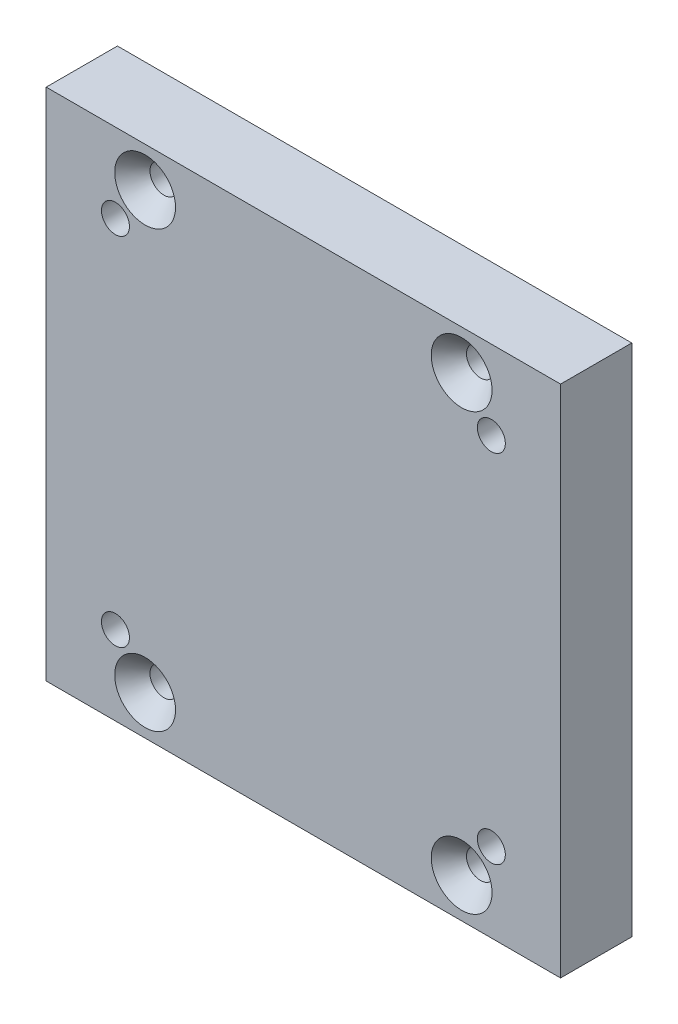
from build123d import *

# Parameters (mm, degrees)
SKETCH1_W                                      = 82.55
SKETCH1_H                                      = 82.55
BOSS_EXTRUDE1_DEPTH                            = 11.43
SKETCH2_R                                      = 38.1
CUT_EXTRUDE1_DEPTH                             = 8.89
CSK_FOR_8_FLAT_HEAD_MACHINE_SCREW1_D           = 4.4958
CSK_FOR_8_FLAT_HEAD_MACHINE_SCREW1_CSINK_D     = 9.7576132
CSK_FOR_8_FLAT_HEAD_MACHINE_SCREW1_CSINK_ANGLE = 82
F_8_CLEARANCE_HOLE1_D                          = 4.4958


with BuildPart() as part:
    # Sketch1 → Boss-Extrude1 (new body)
    with BuildSketch(Plane.XY):
        Rectangle(SKETCH1_W, SKETCH1_H)
    extrude(amount=BOSS_EXTRUDE1_DEPTH)

    # Sketch2 → Cut-Extrude1 (cut)
    with BuildSketch(Plane(origin=(0, 0, 0), x_dir=(-1, 0, 0), z_dir=(0, 0, -1))):
        Circle(SKETCH2_R)
    extrude(amount=-CUT_EXTRUDE1_DEPTH, mode=Mode.SUBTRACT)

    # CSK for #8 Flat Head Machine Screw1 (through all)
    with Locations(Plane.XY.offset(11.43)):
        with Locations((25.4, 34.925), (-25.4, 34.925), (-25.4, -34.925), (25.4, -34.925)):
            CounterSinkHole(CSK_FOR_8_FLAT_HEAD_MACHINE_SCREW1_D / 2, CSK_FOR_8_FLAT_HEAD_MACHINE_SCREW1_CSINK_D / 2, counter_sink_angle=CSK_FOR_8_FLAT_HEAD_MACHINE_SCREW1_CSINK_ANGLE)

    # #8 Clearance Hole1 (through all)
    with Locations(Plane.XY.offset(11.43)):
        with Locations((30.1625, -28.575), (-30.1625, 28.575), (-30.1625, -28.575), (30.1625, 28.575)):
            Hole(F_8_CLEARANCE_HOLE1_D / 2)


solid = part.part
